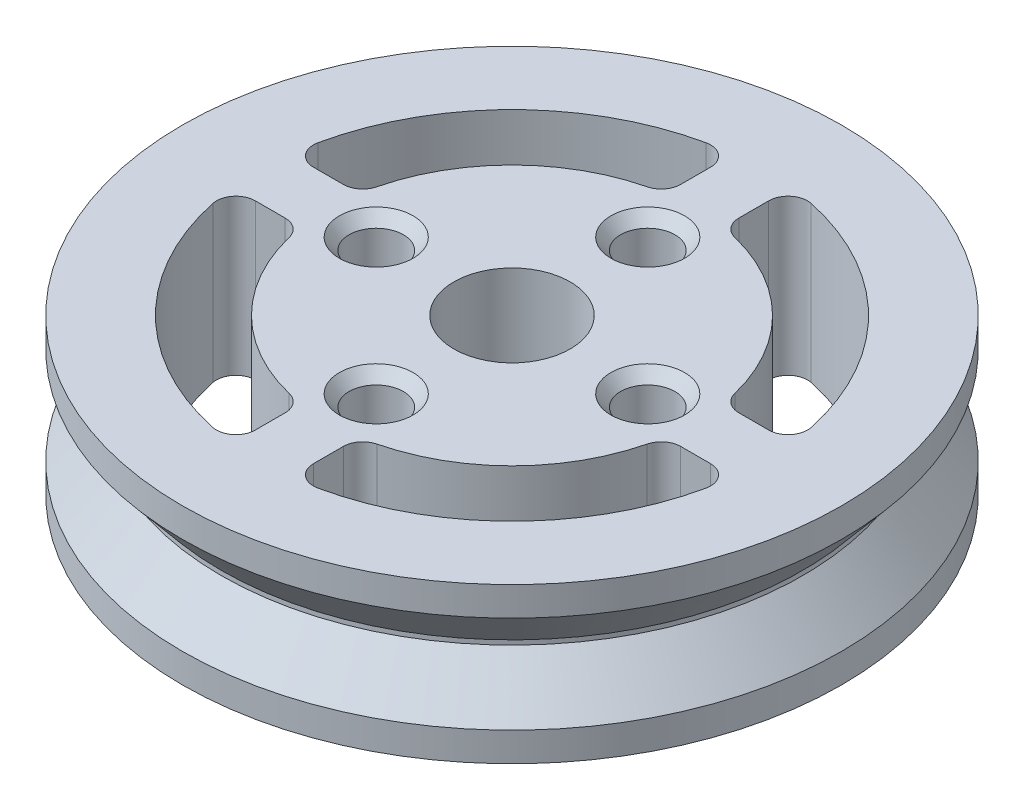
from build123d import *
from OCP.BRepFilletAPI import BRepFilletAPI_MakeChamfer

# Parameters (mm, degrees)
SKETCH_1_R          = 17
SKETCH_1_R_2        = 1.4
EXTRUDE_1_DEPTH     = 8
SKETCH_2_W          = 2
SKETCH_2_H          = 5
SKETCH_5_R          = 1.4
CUT_EXTRUDE_3_DEPTH = 6
SKETCH_6_R          = 8.5
EXTRUDE_2_DEPTH     = 6
SKETCH_4_R          = 3
CUT_EXTRUDE_2_DEPTH = 28.820855486
SKETCH_7_R          = 9.5
SKETCH_7_R_2        = 8.5
EXTRUDE_3_DEPTH     = 1
CHAMFER_1_SIZE      = 2.383507185
CHAMFER_1_SIZE_2    = 2
FILLET_1_R          = 0.5
CUT_EXTRUDE_START   = -10
CUT_EXTRUDE_4_DEPTH = 10
FILLET_2_R          = 1
CHAMFER_2_SIZE      = 0.5
CHAMFER_2_SIZE2     = 0.595876796


with BuildPart() as part:
    # 草图1 → 凸台-拉伸1 (new body)
    # profile 1 of 5: a face of its own
    with BuildSketch(Plane(origin=(0, 0, 0), x_dir=(1, 0, 0), z_dir=(0, 1, 0))):
        with Locations(Location((0, 0, 0), (0, 0, 270))):
            Circle(SKETCH_1_R)
        with Locations((-7, 0)):
            Circle(SKETCH_1_R_2, mode=Mode.SUBTRACT)
        with Locations((0, -7)):
            Circle(SKETCH_1_R_2, mode=Mode.SUBTRACT)
        with Locations((7, 0)):
            Circle(SKETCH_1_R_2, mode=Mode.SUBTRACT)
        with Locations((0, 7)):
            Circle(SKETCH_1_R_2, mode=Mode.SUBTRACT)
    # profile 2 of 5: a face of its own
    with BuildSketch(Plane(origin=(0, 0, 0), x_dir=(1, 0, 0), z_dir=(0, 1, 0))):
        with Locations((0, 7)):
            Circle(SKETCH_1_R_2)
    # profile 3 of 5: a face of its own
    with BuildSketch(Plane(origin=(0, 0, 0), x_dir=(1, 0, 0), z_dir=(0, 1, 0))):
        with Locations((-7, 0)):
            Circle(SKETCH_1_R_2)
    # profile 4 of 5: a face of its own
    with BuildSketch(Plane(origin=(0, 0, 0), x_dir=(1, 0, 0), z_dir=(0, 1, 0))):
        with Locations((0, -7)):
            Circle(SKETCH_1_R_2)
    # profile 5 of 5: a face of its own
    with BuildSketch(Plane(origin=(0, 0, 0), x_dir=(1, 0, 0), z_dir=(0, 1, 0))):
        with Locations((7, 0)):
            Circle(SKETCH_1_R_2)
    extrude(amount=EXTRUDE_1_DEPTH)

    # 草图2 → 切除-旋转1 (revolve, cut)
    with BuildSketch(Plane.XY, mode=Mode.PRIVATE) as cut_revolve_1_sk:
        with Locations((16, 4)):
            Rectangle(SKETCH_2_W, SKETCH_2_H)
    revolve(cut_revolve_1_sk.sketch.rotate(Axis((0, 8, 0), (0, -1, 0)), 90), axis=Axis((0, 8, 0), (0, -1, 0)), mode=Mode.SUBTRACT)

    # 草图5 → 切除-拉伸3 (cut)
    with BuildSketch(Plane(origin=(0, 8, 0), x_dir=(1, 0, 0), z_dir=(0, 1, 0))):
        with Locations(Location((0, 7, 0), (0, 0, 270))):
            Circle(SKETCH_5_R)
        with Locations(Location((7, 0, 0), (0, 0, 270))):
            Circle(SKETCH_5_R)
        with Locations(Location((0, -7, 0), (0, 0, 270))):
            Circle(SKETCH_5_R)
        with Locations(Location((-7, 0, 0), (0, 0, 270))):
            Circle(SKETCH_5_R)
    extrude(amount=-CUT_EXTRUDE_3_DEPTH, mode=Mode.SUBTRACT)

    # 草图6 → 凸台-拉伸2 (add)
    with BuildSketch(Plane.XZ):
        with Locations(Location((0, 0, 0), (0, 0, 270))):
            Circle(SKETCH_6_R)
    extrude(amount=EXTRUDE_2_DEPTH)

    # 草图4 → 切除-拉伸2 (cut, through all)
    with BuildSketch(Plane(origin=(0, 8, 0), x_dir=(1, 0, 0), z_dir=(0, 1, 0))):
        with Locations(Location((0, 0, 0), (0, 0, 270))):
            Circle(SKETCH_4_R)
    extrude(amount=-CUT_EXTRUDE_2_DEPTH, mode=Mode.SUBTRACT)

    # 草图7 → 凸台-拉伸3 (add)
    with BuildSketch(Plane.XZ):
        with Locations(Location((0, 0, 0), (0, 0, 90))):
            Circle(SKETCH_7_R)
        with Locations(Location((0, 0, 0), (0, 0, 270))):
            Circle(SKETCH_7_R_2, mode=Mode.SUBTRACT)
    extrude(amount=EXTRUDE_3_DEPTH)

    # 倒角1
    chamfer_1_edges_1 = [part.edges().sort_by_distance(p)[0] for p in [
        (0, 6.5, -15),
    ]]
    chamfer_1_side_1 = [part.faces().sort_by_distance(p)[0] for p in [
        (0, 6.46, -15),
    ]]
    chamfer_1_edges_2 = [part.edges().sort_by_distance(p)[0] for p in [
        (0, 1.5, -15),
    ]]
    chamfer_1_side_2 = [part.faces().sort_by_distance(p)[0] for p in [
        (0, 1.5, -15.04),
    ]]
    chamfer_1 = BRepFilletAPI_MakeChamfer(part.part.solid().wrapped)
    for e in chamfer_1_edges_1:
        chamfer_1.Add(CHAMFER_1_SIZE - 0.0001, CHAMFER_1_SIZE_2 - 0.0001, e.wrapped, chamfer_1_side_1[0].wrapped)
    for e in chamfer_1_edges_2:
        chamfer_1.Add(CHAMFER_1_SIZE_2 - 0.0001, CHAMFER_1_SIZE - 0.0001, e.wrapped, chamfer_1_side_2[0].wrapped)
    add(Compound.cast(chamfer_1.Shape()), mode=Mode.REPLACE)  # a hair under: the kernel refuses the full size

    # 圆角1
    fillet_1_edges = [part.edges().sort_by_distance(p)[0] for p in [
        (0, -6, 8.5),
    ]]
    fillet(fillet_1_edges, radius=FILLET_1_R)

    # 草图8 → 切除-拉伸4 (cut)
    with BuildSketch(Plane.XZ.offset(CUT_EXTRUDE_START)):
        with BuildLine():
            Line((-1.5, 9.38083152), (-1.5, 12.91317157))
            ThreePointArc((-1.5, 12.91317157), (-9.192388155, 9.192388155), (-12.91317157, 1.5))
            Line((-12.91317157, 1.5), (-9.38083152, 1.5))
            ThreePointArc((-9.38083152, 1.5), (-6.717514421, 6.717514421), (-1.5, 9.38083152))
        make_face()
        with BuildLine():
            Line((-9.38083152, -1.5), (-12.91317157, -1.5))
            ThreePointArc((-12.91317157, -1.5), (-9.192388155, -9.192388155), (-1.5, -12.91317157))
            Line((-1.5, -12.91317157), (-1.5, -9.38083152))
            ThreePointArc((-1.5, -9.38083152), (-6.717514421, -6.717514421), (-9.38083152, -1.5))
        make_face()
        with BuildLine():
            ThreePointArc((1.5, -12.91317157), (9.192388155, -9.192388155), (12.91317157, -1.5))
            Line((12.91317157, -1.5), (9.38083152, -1.5))
            ThreePointArc((9.38083152, -1.5), (6.717514421, -6.717514421), (1.5, -9.38083152))
            Line((1.5, -9.38083152), (1.5, -12.91317157))
        make_face()
        with BuildLine():
            ThreePointArc((12.91317157, 1.5), (9.192388155, 9.192388155), (1.5, 12.91317157))
            Line((1.5, 12.91317157), (1.5, 9.38083152))
            ThreePointArc((1.5, 9.38083152), (6.717514421, 6.717514421), (9.38083152, 1.5))
            Line((9.38083152, 1.5), (12.91317157, 1.5))
        make_face()
    extrude(amount=CUT_EXTRUDE_4_DEPTH, mode=Mode.SUBTRACT)

    # 圆角2
    fillet_2_edges = [part.edges().sort_by_distance(p)[0] for p in [
        (-1.5, 4, 12.91317157),
        (-1.5, 4, 9.38083152),
        (-9.38083152, 4, 1.5),
        (-12.91317157, 4, 1.5),
        (12.91317157, 4, 1.5),
        (9.38083152, 4, 1.5),
        (1.5, 4, 9.38083152),
        (1.5, 4, 12.91317157),
        (1.5, 4, -12.91317157),
        (1.5, 4, -9.38083152),
        (9.38083152, 4, -1.5),
        (12.91317157, 4, -1.5),
        (-12.91317157, 4, -1.5),
        (-9.38083152, 4, -1.5),
        (-1.5, 4, -9.38083152),
        (-1.5, 4, -12.91317157),
    ]]
    fillet(fillet_2_edges, radius=FILLET_2_R)

    # 倒角2
    chamfer_2_edges = [part.edges().sort_by_distance(p)[0] for p in [
        (0, 8, -8.4),
        (7, 8, -1.4),
        (0, 8, 5.6),
        (-7, 8, -1.4),
    ]]
    chamfer_2_side = [part.faces().sort_by_distance(p)[0] for p in [
        (-10.967366811, 8, 1.019167389),
    ]]
    chamfer(chamfer_2_edges, length=CHAMFER_2_SIZE, length2=CHAMFER_2_SIZE2, reference=chamfer_2_side[0])


solid = part.part
